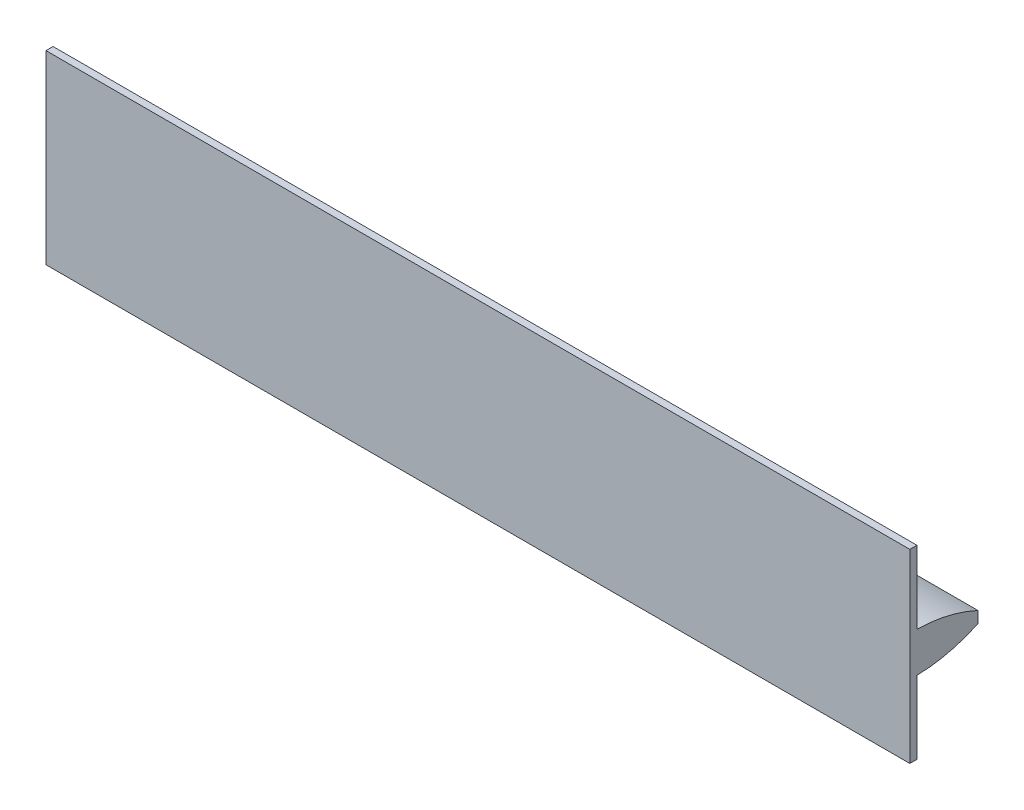
from build123d import *

# Parameters (mm, degrees)
BOSS_EXTRUDE2_DEPTH = 482.6


with BuildPart() as part:
    # Sketch2 → Boss-Extrude2 (new body)
    with BuildSketch(Plane(origin=(0, 0, 0), x_dir=(0, 0, -1), z_dir=(1, 0, 0))):
        with BuildLine():
            Line((0, 0), (0, 51.806487563))
            Line((0, 51.806487563), (3.96875, 51.806487563))
            Line((3.96875, 51.806487563), (3.96875, 11.151453071))
            ThreePointArc((3.96875, 11.151453071), (21.455972099, 8.967240909), (38.1, 3.175))
            Line((38.1, 3.175), (38.1, 0))
            Line((38.1, 0), (0, 0))
        make_face()
    boss_extrude2 = extrude(amount=-BOSS_EXTRUDE2_DEPTH)

    # Mirror1: Boss-Extrude2 across plane
    add(boss_extrude2.mirror(Plane(origin=(-482.6, 0, 0), x_dir=(0, 0, 1), z_dir=(0, -1, 0))))


solid = part.part
